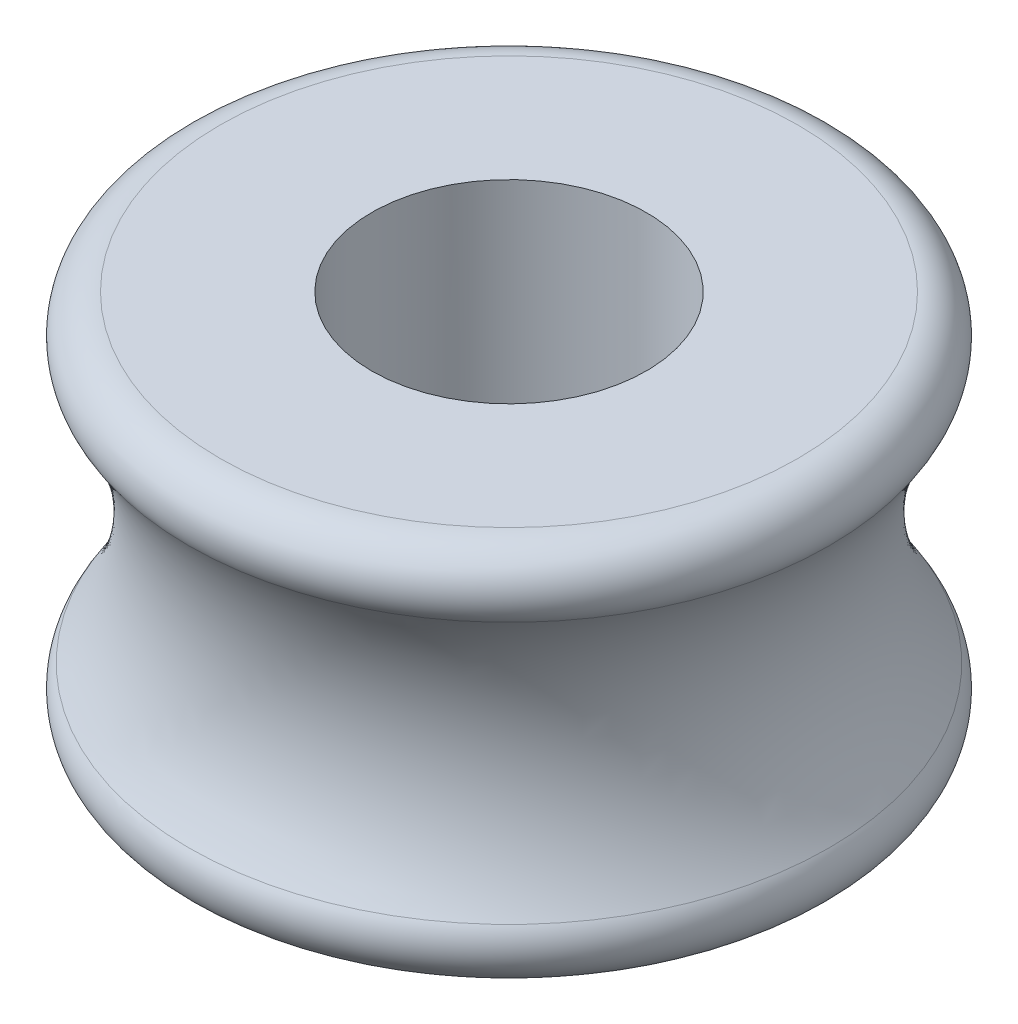
from build123d import *

# Parameters (mm, degrees)
CHAMFER1_SIZE = 0.5


with BuildPart() as part:
    # Sketch1 → Revolve1 (revolve)
    with BuildSketch(Plane.XY):
        with BuildLine():
            Line((-3.786031072, 0), (-1.8, 0))
            Line((-1.8, 0), (-1.8, -5))
            Line((-1.8, -5), (-3.786031072, -5))
            ThreePointArc((-3.786031072, -5), (-4.229233702, -4.731455025), (-4.196356975, -4.214285714))
            ThreePointArc((-4.196356975, -4.214285714), (-3.658312395, -2.5), (-4.196356975, -0.785714286))
            ThreePointArc((-4.196356975, -0.785714286), (-4.229233702, -0.268544975), (-3.786031072, 0))
        make_face()
    revolve(axis=Axis((0, 0, 0), (0, -1, 0)))

    # Chamfer1
    chamfer1_edges = [part.edges().sort_by_distance(p)[0] for p in [
        (1.8, -5, 0),
    ]]
    chamfer(chamfer1_edges, length=CHAMFER1_SIZE)


solid = part.part
